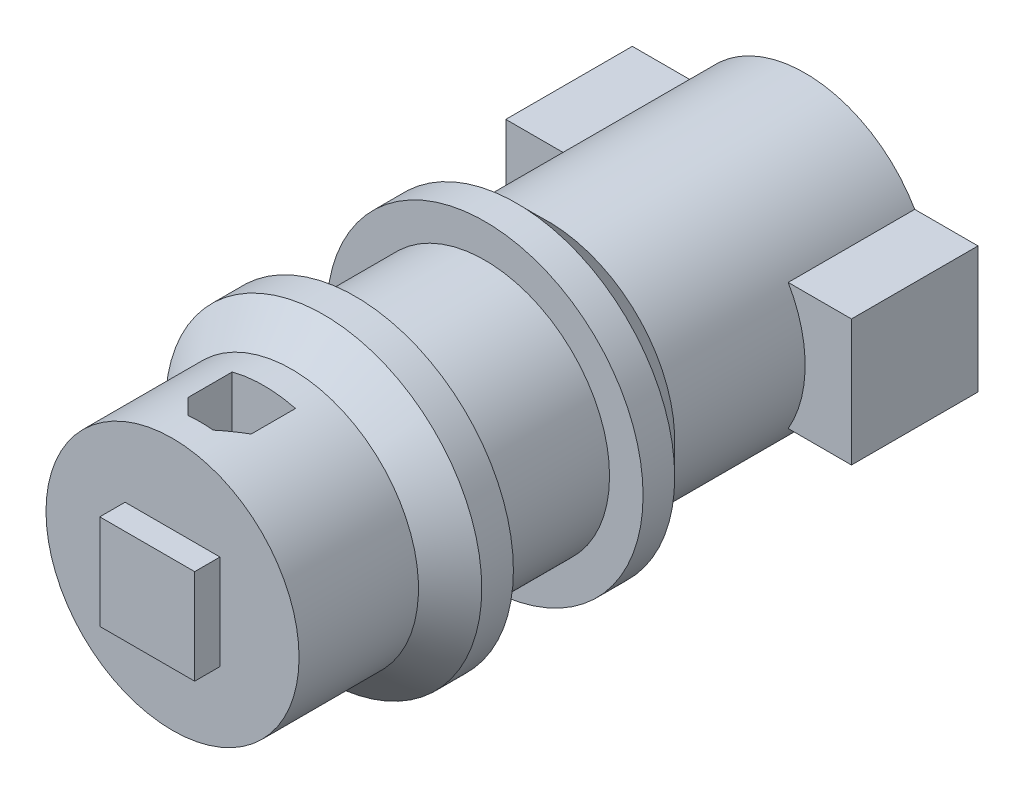
from build123d import *

# Parameters (mm, degrees)
SKETCH1_R           = 10
BOSS_EXTRUDE1_DEPTH = 50
BOSS_EXTRUDE2_DEPTH = 10
BOSS_EXTRUDE5_START = -25.31
SKETCH6_R           = 12.5
BOSS_EXTRUDE5_DEPTH = 5
LPATTERN1_COUNT     = 2
LPATTERN1_PITCH     = 15.25
CHAMFER2_SIZE       = 2.5
CUT_EXTRUDE1_START  = 10
SKETCH7_W           = 5
SKETCH7_H           = 5
CUT_EXTRUDE1_DEPTH  = 5
CHAMFER3_SIZE       = 1.5
SKETCH8_W           = 7.5
SKETCH8_H           = 7.5
BOSS_EXTRUDE6_DEPTH = 2
SKETCH10_R          = 10
SKETCH10_R_2        = 9.85
CUT_EXTRUDE3_DEPTH  = 10.25


with BuildPart() as part:
    # Sketch1 → Boss-Extrude1 (new body)
    with BuildSketch(Plane.XY):
        Circle(SKETCH1_R)
    extrude(amount=BOSS_EXTRUDE1_DEPTH)

    # Sketch2 → Boss-Extrude2 (add)
    with BuildSketch(Plane(origin=(0, 0, 0), x_dir=(-1, 0, 0), z_dir=(0, 0, -1))):
        with BuildLine():
            Line((-8.660254038, 5), (-13.660254038, 5))
            Line((-13.660254038, 5), (-13.660254038, -5))
            Line((-13.660254038, -5), (-8.660254038, -5))
            ThreePointArc((-8.660254038, -5), (-10, 0), (-8.660254038, 5))
        make_face()
        with BuildLine():
            Line((8.660254038, -5), (13.660254038, -5))
            Line((13.660254038, -5), (13.660254038, 5))
            Line((13.660254038, 5), (8.660254038, 5))
            ThreePointArc((8.660254038, 5), (10, 0), (8.660254038, -5))
        make_face()
    extrude(amount=-BOSS_EXTRUDE2_DEPTH)

    # Sketch6 → Boss-Extrude5 (add)
    with BuildSketch(Plane(origin=(0, 0, 0), x_dir=(-1, 0, 0), z_dir=(0, 0, -1)).offset(BOSS_EXTRUDE5_START)):
        Circle(SKETCH6_R)
    boss_extrude5 = extrude(amount=BOSS_EXTRUDE5_DEPTH)

    # LPattern1: Boss-Extrude5 ×2
    with Locations(*[(0, 0, i * LPATTERN1_PITCH) for i in range(1, LPATTERN1_COUNT)]):
        add(boss_extrude5)

    # Chamfer2
    chamfer2_edges = [part.edges().sort_by_distance(p)[0] for p in [
        (12.5, 0, 20.31),
        (12.5, 0, 40.56),
    ]]
    chamfer(chamfer2_edges, length=CHAMFER2_SIZE - 0.0001)  # a hair under: the kernel refuses the full size

    # Sketch7 → Cut-Extrude1 (cut)
    with BuildSketch(Plane(origin=(0, 0, 0), x_dir=(1, 0, 0), z_dir=(0, 1, 0)).offset(CUT_EXTRUDE1_START)):
        with Locations((0, -45.28)):
            Rectangle(SKETCH7_W, SKETCH7_H)
    extrude(amount=-CUT_EXTRUDE1_DEPTH, mode=Mode.SUBTRACT)

    # Chamfer3
    chamfer3_edges = [part.edges().sort_by_distance(p)[0] for p in [
        (2.5, 7.341229183, 47.78),
        (-2.5, 7.341229183, 47.78),
    ]]
    chamfer(chamfer3_edges, length=CHAMFER3_SIZE)

    # Sketch8 → Boss-Extrude6 (add)
    with BuildSketch(Plane.XY.offset(50)):
        Rectangle(SKETCH8_W, SKETCH8_H)
    extrude(amount=BOSS_EXTRUDE6_DEPTH)

    # Sketch10 → Cut-Extrude3 (cut)
    with BuildSketch(Plane.XY.offset(25.31)):
        with Locations(Location((0, 0, 0), (0, 0, 180))):
            Circle(SKETCH10_R)
        with Locations(Location((0, 0, 0), (0, 0, 180))):
            Circle(SKETCH10_R_2, mode=Mode.SUBTRACT)
    extrude(amount=CUT_EXTRUDE3_DEPTH, mode=Mode.SUBTRACT)


solid = part.part
